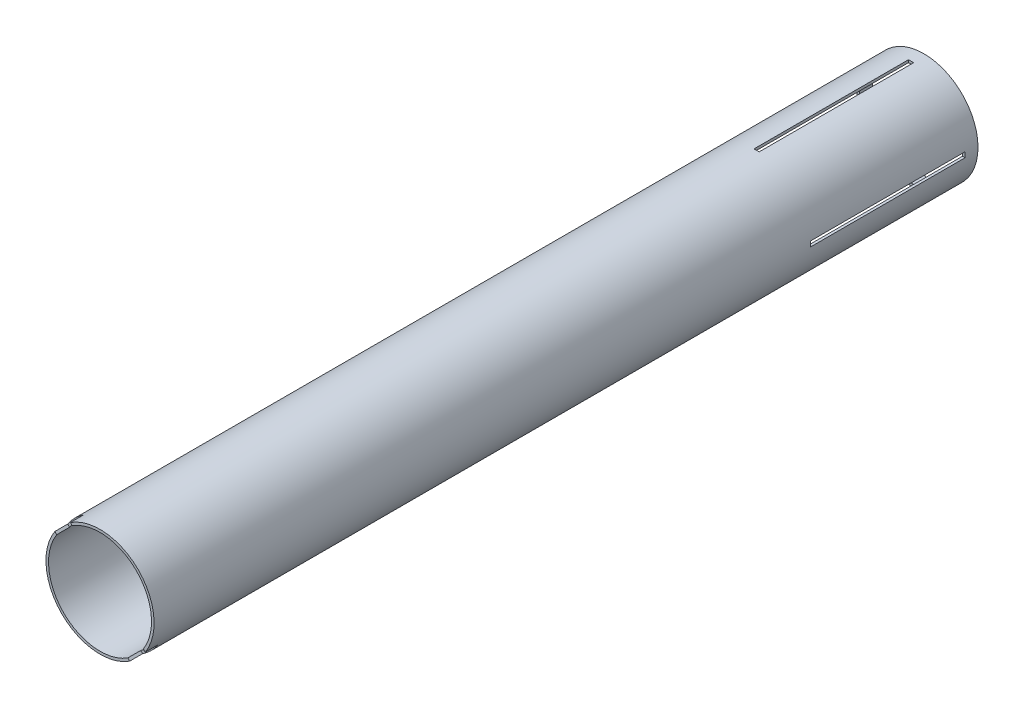
from build123d import *

# Parameters (mm, degrees)
SKETCH1_R               = 53.34
SKETCH1_R_2             = 50.8
BOSS_EXTRUDE1_DEPTH     = 812.8
CUT_EXTRUDE1_REACH      = 818.293
SKETCH2_W               = 152.4
SKETCH2_H               = 5.08
CIRPATTERN1_COUNT       = 4
CUT_EXTRUDE2_DEPTH      = 817.292932225
CUT_EXTRUDE2_DEPTH_BACK = 817.292932225
SKETCH3_W               = 12.7
SKETCH3_H               = 21.59


with BuildPart() as part:
    # Sketch1 → Boss-Extrude1 (new body)
    with BuildSketch(Plane.XY):
        Circle(SKETCH1_R)
        Circle(SKETCH1_R_2, mode=Mode.SUBTRACT)
    extrude(amount=BOSS_EXTRUDE1_DEPTH)

    # Sketch2 → Cut-Extrude1 (cut, up to next)
    with BuildSketch(Plane(origin=(0, 0, 0), x_dir=(0, 0, -1), z_dir=(1, 0, 0)), mode=Mode.PRIVATE) as cut_extrude1_sk1:
        with Locations((-88.9, 0)):
            Rectangle(SKETCH2_W, SKETCH2_H)
    cut_extrude1_tool1 = extrude(cut_extrude1_sk1.sketch, amount=-CUT_EXTRUDE1_REACH, mode=Mode.PRIVATE) & part.part
    cut_extrude1 = cut_extrude1_tool1.solids().sort_by_distance((0, 0, 88.9))[0]
    add(cut_extrude1, mode=Mode.SUBTRACT)

    # CirPattern1: Cut-Extrude1 ×4 about axis
    cirpattern1_axis = Axis((0, 0, -40.64), (0, 0, 1))
    for i in range(1, CIRPATTERN1_COUNT):
        add(cut_extrude1.rotate(cirpattern1_axis, i * 360 / CIRPATTERN1_COUNT), mode=Mode.SUBTRACT)

    # Sketch3 → Cut-Extrude2 (cut, two sides: drawn at the far end of the back side and taken through both)
    with BuildSketch(Plane(origin=(0, 0, 0), x_dir=(0, 0, 1), z_dir=(-0.7071067811865488, 0.7071067811865464, 0)).offset(-CUT_EXTRUDE2_DEPTH_BACK)):
        with Locations((806.45, 0)):
            Rectangle(SKETCH3_W, SKETCH3_H)
    extrude(amount=CUT_EXTRUDE2_DEPTH + CUT_EXTRUDE2_DEPTH_BACK, mode=Mode.SUBTRACT)


solid = part.part
